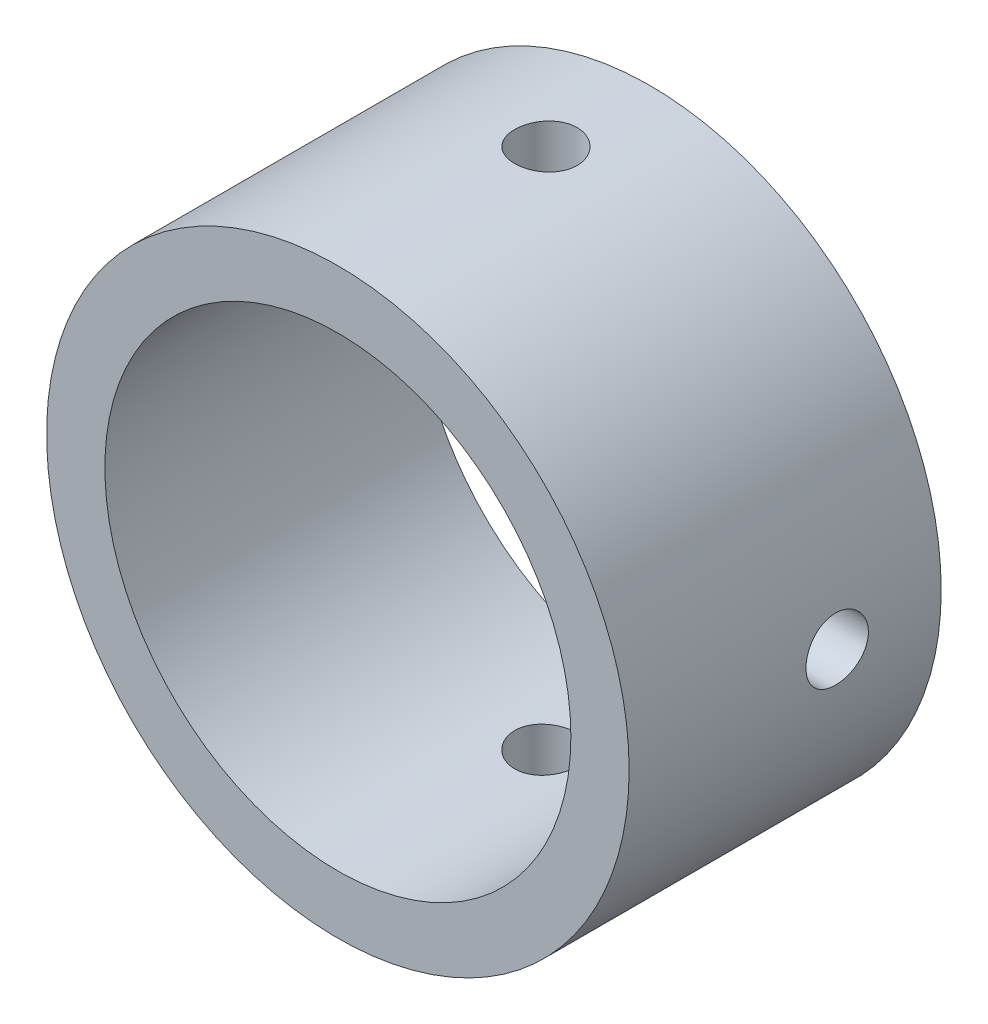
from build123d import *

# Parameters (mm, degrees)
BOSS_EXTRUDE1_DEPTH      = 10
BOSS_EXTRUDE1_DEPTH_BACK = 5
SKETCH1_R                = 14
SKETCH1_R_2              = 11.2
CUT_EXTRUDE1_DEPTH       = 23.181073013
CUT_EXTRUDE1_DEPTH_BACK  = 23.181073013
SKETCH2_R                = 1.5
SKETCH3_R                = 1.5
CUT_EXTRUDE2_DEPTH       = 23.181073203


with BuildPart() as part:
    # Sketch1 → Boss-Extrude1 (new, two sides: drawn at the far end of the back side and taken through both)
    with BuildSketch(Plane.XY.offset(-BOSS_EXTRUDE1_DEPTH_BACK)):
        Circle(SKETCH1_R)
        Circle(SKETCH1_R_2, mode=Mode.SUBTRACT)
    extrude(amount=BOSS_EXTRUDE1_DEPTH + BOSS_EXTRUDE1_DEPTH_BACK)

    # Sketch2 → Cut-Extrude1 (cut, two sides: drawn at the far end of the back side and taken through both)
    with BuildSketch(Plane(origin=(0, 0, 0), x_dir=(1, 0, 0), z_dir=(0, 1, 0)).offset(-CUT_EXTRUDE1_DEPTH_BACK)):
        Circle(SKETCH2_R)
    extrude(amount=CUT_EXTRUDE1_DEPTH + CUT_EXTRUDE1_DEPTH_BACK, mode=Mode.SUBTRACT)

    # Sketch3 → Cut-Extrude2 (cut, through all)
    with BuildSketch(Plane(origin=(0, 0, 0), x_dir=(0, 0, -1), z_dir=(1, 0, 0))):
        Circle(SKETCH3_R)
    extrude(amount=CUT_EXTRUDE2_DEPTH, mode=Mode.SUBTRACT)


solid = part.part
